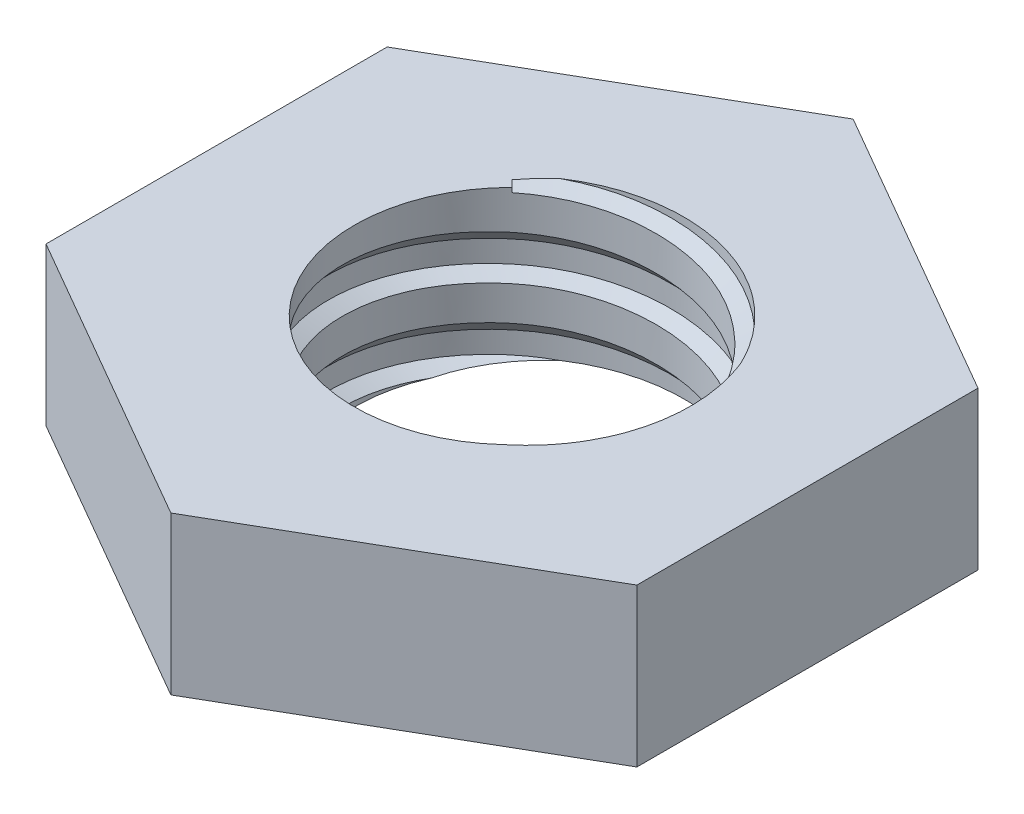
from build123d import *

# Parameters (mm, degrees)
BOSS_EXTRUDE1_DEPTH = 4
SKETCH3_R           = 4
CUT_EXTRUDE1_DEPTH  = 5
CUT_SWEEP2_PITCH    = 2


with BuildPart() as part:
    # Sketch2 → Boss-Extrude1 (new body)
    with BuildSketch(Plane(origin=(0, 0, 0), x_dir=(1, 0, 0), z_dir=(0, 1, 0))):
        Polygon((0, 8.660254038), (-7.5, 4.330127019), (-7.5, -4.330127019), (0, -8.660254038), (7.5, -4.330127019), (7.5, 4.330127019), align=None)
    extrude(amount=BOSS_EXTRUDE1_DEPTH)

    # Sketch3 → Cut-Extrude1 (cut)
    with BuildSketch(Plane(origin=(0, 4, 0), x_dir=(1, 0, 0), z_dir=(0, 1, 0))):
        with Locations(Location((0, 0, 0), (0, 0, 270))):
            Circle(SKETCH3_R)
    extrude(amount=-CUT_EXTRUDE1_DEPTH, mode=Mode.SUBTRACT)

    # Cut-Sweep2: arcs per turn and ends read off the stored shape
    # Cut-Sweep2: the profile of Sketch5 screwed along a right-hand helix through 60.5 turns, 6 arcs to a turn; built about Z, then put on its axis
    cut_sweep2_z = Axis((0, 0, 0), (0, 0, 1))
    cut_sweep2_corners = [(3.989683597, 1.393e-06, -0.022767551), (4.360754798, 1.522e-06, 0.387649999), (4.360754798, 1.522e-06, 0.940228576), (3.989683597, 1.393e-06, 1.121019129)]
    with BuildLine(mode=Mode.PRIVATE) as cut_sweep2_profile:
        Line(cut_sweep2_corners[0], cut_sweep2_corners[1])
        Line(cut_sweep2_corners[1], cut_sweep2_corners[2])
        Line(cut_sweep2_corners[2], cut_sweep2_corners[3])
        Line(cut_sweep2_corners[3], cut_sweep2_corners[0])
    cut_sweep2_cap = Face(cut_sweep2_profile.wire())
    cut_sweep2_turn_angles = [0, 30, 60, 90, 120, 150, 180, 210, 240, 270, 300, 330, 360]
    cut_sweep2_turn_weights = [1, 0.8660254037844387, 1, 0.8660254037844387, 1, 0.8660254037844387, 1, 0.8660254037844387, 1, 0.8660254037844387, 1, 0.8660254037844387, 1]
    cut_sweep2_turn_rails = [Edge.make_bspline([Vector(p[0], p[1], 0).rotate(cut_sweep2_z, cut_sweep2_turn_angles[k]) / cut_sweep2_turn_weights[k] + Vector(0, 0, p[2] + CUT_SWEEP2_PITCH * cut_sweep2_turn_angles[k] / 360) for k in range(13)], [0, 0, 0, 1, 1, 2, 2, 3, 3, 4, 4, 5, 5, 6, 6, 6], 2, cut_sweep2_turn_weights) for p in cut_sweep2_corners]
    cut_sweep2_turn_sides = [Face.make_surface_from_curves(cut_sweep2_turn_rails[p[0]], cut_sweep2_turn_rails[p[1]]) for p in [(0, 1), (1, 2), (2, 3), (3, 0)]]
    cut_sweep2_last_angles = [21600, 21630, 21660, 21690, 21720, 21750, 21780]
    cut_sweep2_last_weights = [1, 0.8660254037844387, 1, 0.8660254037844387, 1, 0.8660254037833434, 1]
    cut_sweep2_last_rails = [Edge.make_bspline([Vector(p[0], p[1], 0).rotate(cut_sweep2_z, cut_sweep2_last_angles[k]) / cut_sweep2_last_weights[k] + Vector(0, 0, p[2] + CUT_SWEEP2_PITCH * cut_sweep2_last_angles[k] / 360) for k in range(7)], [0, 0, 0, 1, 1, 2, 2, 3, 3, 3], 2, cut_sweep2_last_weights) for p in cut_sweep2_corners]
    cut_sweep2_last_sides = [Face.make_surface_from_curves(cut_sweep2_last_rails[p[0]], cut_sweep2_last_rails[p[1]]) for p in [(0, 1), (1, 2), (2, 3), (3, 0)]]
    cut_sweep2 = Plane(origin=(0, 5, 0), x_dir=(-0.7071067811865537, 0, -0.7071067811865414), z_dir=(0, -1, 0)) * Solid(Shell([*[p.moved(Location((0, 0, CUT_SWEEP2_PITCH * i))) for i in range(60) for p in cut_sweep2_turn_sides], *cut_sweep2_last_sides, cut_sweep2_cap, cut_sweep2_cap.rotate(cut_sweep2_z, 21780).moved(Location((0, 0, CUT_SWEEP2_PITCH * 21780 / 360)))]))
    add(cut_sweep2, mode=Mode.SUBTRACT)


solid = part.part
